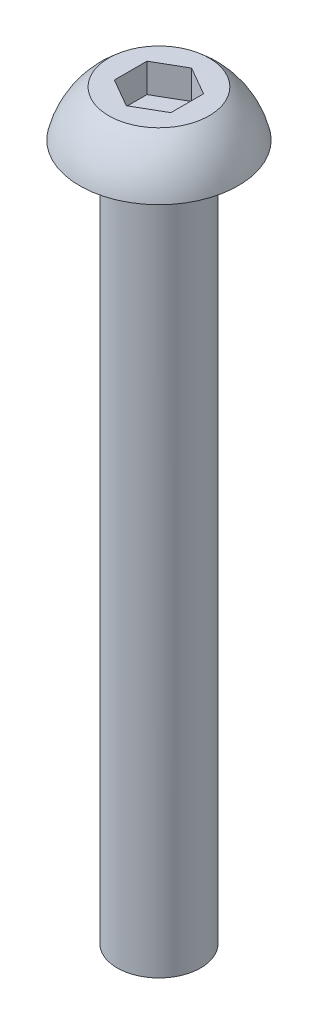
from build123d import *

# Parameters (mm, degrees)
CUT_EXTRUDE_1_DEPTH = 1.04
FILLET_1_R          = 0.1


with BuildPart() as part:
    # 草图1 → 旋转1 (revolve)
    with BuildSketch(Plane.XY):
        with BuildLine():
            Line((0, 2.304545455), (-1.8, 2.304545455))
            ThreePointArc((-1.8, 2.304545455), (-2.467032631, 1.569929856), (-2.85, 0.654545455))
            Line((-2.85, 0.654545455), (-1.5, 0.654545455))
            Line((-1.5, 0.654545455), (-1.5, -24.345454545))
            Line((-1.5, -24.345454545), (0, -24.345454545))
            Line((0, -24.345454545), (0, 2.304545455))
        make_face()
    revolve(axis=Axis((0, 0, 0), (0, 1, 0)))

    # 草图2 → 切除-拉伸1 (cut)
    with BuildSketch(Plane(origin=(0, 2.304545455, 0), x_dir=(1, 0, 0), z_dir=(0, 1, 0))):
        Polygon((0, -1.172021046), (1.015, -0.586010523), (1.015, 0.586010523), (0, 1.172021046), (-1.015, 0.586010523), (-1.015, -0.586010523), align=None)
    extrude(amount=-CUT_EXTRUDE_1_DEPTH, mode=Mode.SUBTRACT)

    # 圆角1
    fillet_1_edges = [part.edges().sort_by_distance(p)[0] for p in [
        (1.5, 0.654545455, 0),
    ]]
    fillet(fillet_1_edges, radius=FILLET_1_R)


solid = part.part
